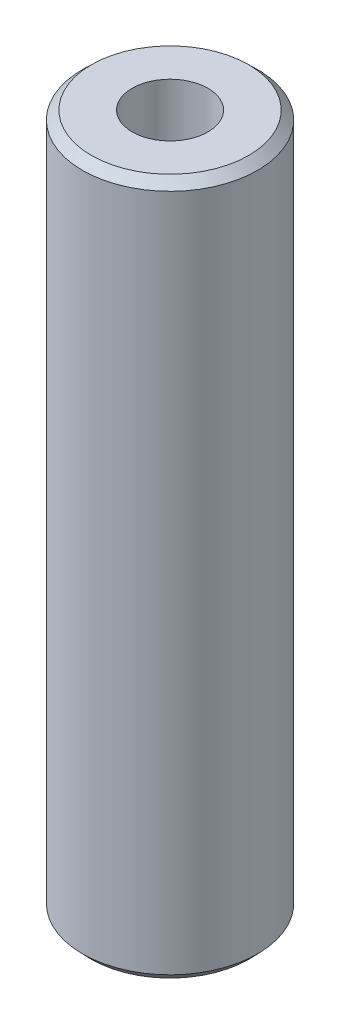
from build123d import *
from OCP.BRepFilletAPI import BRepFilletAPI_MakeChamfer

# Parameters (mm, degrees)
SKETCH1_R           = 40
BOSS_EXTRUDE1_DEPTH = 318.233432006
SKETCH2_R           = 17.309567305
CUT_EXTRUDE1_DEPTH  = 324.22208657
CHAMFER1_SIZE       = 3.898436333
CHAMFER1_SIZE2      = 4.04612359


with BuildPart() as part:
    # Sketch1 → Boss-Extrude1 (new body)
    with BuildSketch(Plane(origin=(0, 0, 0), x_dir=(1, 0, 0), z_dir=(0, 1, 0))):
        Circle(SKETCH1_R)
    extrude(amount=BOSS_EXTRUDE1_DEPTH)

    # Sketch2 → Cut-Extrude1 (cut, through all)
    with BuildSketch(Plane(origin=(0, 0, 0), x_dir=(1, 0, 0), z_dir=(0, 1, 0))):
        Circle(SKETCH2_R)
    extrude(amount=CUT_EXTRUDE1_DEPTH, mode=Mode.SUBTRACT)

    # Chamfer1: one chamfer whose edges measure the first distance from different faces: ONE call of the kernel's chamfer builder (chamfer() names one face for all edges)
    chamfer1_edges_1 = [part.edges().sort_by_distance(p)[0] for p in [
        (-40, 318.233432006, 0),
    ]]
    chamfer1_side_1 = [part.faces().sort_by_distance(p)[0] for p in [
        (-40, 159.116716003, 0),
    ]]
    chamfer1_edges_2 = [part.edges().sort_by_distance(p)[0] for p in [
        (-40, 0, 0),
    ]]
    chamfer1_side_2 = [part.faces().sort_by_distance(p)[0] for p in [
        (-38.86862915, 0, 0),
    ]]
    chamfer1 = BRepFilletAPI_MakeChamfer(part.part.solid().wrapped)
    for e in chamfer1_edges_1:
        chamfer1.Add(CHAMFER1_SIZE, CHAMFER1_SIZE2, e.wrapped, chamfer1_side_1[0].wrapped)  # the first distance lies on this face
    for e in chamfer1_edges_2:
        chamfer1.Add(CHAMFER1_SIZE, CHAMFER1_SIZE2, e.wrapped, chamfer1_side_2[0].wrapped)  # the first distance lies on this face
    add(Compound.cast(chamfer1.Shape()), mode=Mode.REPLACE)


solid = part.part
